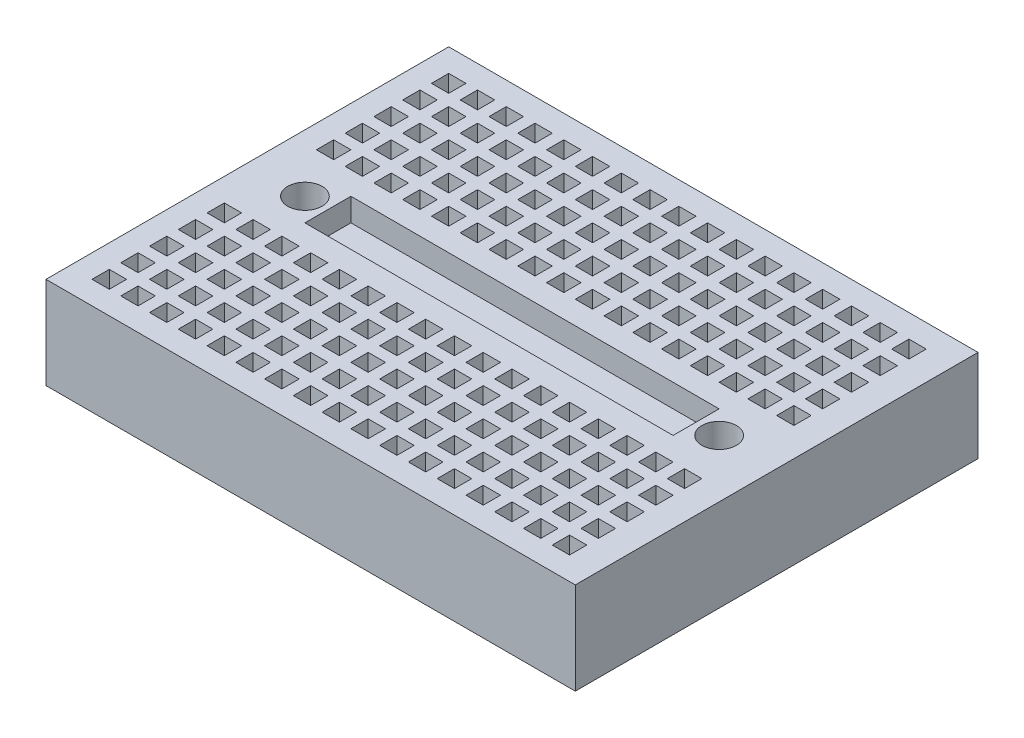
from build123d import *

# Parameters (mm, degrees)
SKETCH1_W           = 46
SKETCH1_H           = 35
SKETCH1_R           = 1.5
BOSS_EXTRUDE1_DEPTH = 8
SKETCH2_W           = 32
SKETCH2_H           = 4
CUT_EXTRUDE1_DEPTH  = 2
SKETCH3_W           = 1.5
SKETCH3_H           = 1.5
CUT_EXTRUDE2_DEPTH  = 7


with BuildPart() as part:
    # Sketch1 → Boss-Extrude1 (new body)
    with BuildSketch(Plane(origin=(0, 0, 0), x_dir=(1, 0, 0), z_dir=(0, 1, 0))):
        Rectangle(SKETCH1_W, SKETCH1_H)
        with Locations((18, 0)):
            Circle(SKETCH1_R, mode=Mode.SUBTRACT)
        with Locations((-18, 0)):
            Circle(SKETCH1_R, mode=Mode.SUBTRACT)
    extrude(amount=BOSS_EXTRUDE1_DEPTH)

    # Sketch2 → Cut-Extrude1 (cut)
    with BuildSketch(Plane(origin=(0, 8, 0), x_dir=(1, 0, 0), z_dir=(0, 1, 0))):
        Rectangle(SKETCH2_W, SKETCH2_H)
    extrude(amount=-CUT_EXTRUDE1_DEPTH, mode=Mode.SUBTRACT)

    # Sketch3 → Cut-Extrude2 (cut)
    with BuildSketch(Plane(origin=(0, 8, 0), x_dir=(1, 0, 0), z_dir=(0, 1, 0))):
        with Locations((-20.25, 14.75)):
            Rectangle(SKETCH3_W, SKETCH3_H)
        with Locations((-17.75, 14.75)):
            Rectangle(SKETCH3_W, SKETCH3_H)
        with Locations((-15.25, 14.75)):
            Rectangle(SKETCH3_W, SKETCH3_H)
        with Locations((-12.75, 14.75)):
            Rectangle(SKETCH3_W, SKETCH3_H)
        with Locations((-10.25, 14.75)):
            Rectangle(SKETCH3_W, SKETCH3_H)
        with Locations((-7.75, 14.75)):
            Rectangle(SKETCH3_W, SKETCH3_H)
        with Locations((-5.25, 14.75)):
            Rectangle(SKETCH3_W, SKETCH3_H)
        with Locations((-2.75, 14.75)):
            Rectangle(SKETCH3_W, SKETCH3_H)
        with Locations((-0.25, 14.75)):
            Rectangle(SKETCH3_W, SKETCH3_H)
        with Locations((2.25, 14.75)):
            Rectangle(SKETCH3_W, SKETCH3_H)
        with Locations((4.75, 14.75)):
            Rectangle(SKETCH3_W, SKETCH3_H)
        with Locations((7.25, 14.75)):
            Rectangle(SKETCH3_W, SKETCH3_H)
        with Locations((9.75, 14.75)):
            Rectangle(SKETCH3_W, SKETCH3_H)
        with Locations((12.25, 14.75)):
            Rectangle(SKETCH3_W, SKETCH3_H)
        with Locations((14.75, 14.75)):
            Rectangle(SKETCH3_W, SKETCH3_H)
        with Locations((17.25, 14.75)):
            Rectangle(SKETCH3_W, SKETCH3_H)
        with Locations((19.75, 14.75)):
            Rectangle(SKETCH3_W, SKETCH3_H)
        with Locations((-17.75, 12.25)):
            Rectangle(SKETCH3_W, SKETCH3_H)
        with Locations((-15.25, 12.25)):
            Rectangle(SKETCH3_W, SKETCH3_H)
        with Locations((-12.75, 12.25)):
            Rectangle(SKETCH3_W, SKETCH3_H)
        with Locations((-10.25, 12.25)):
            Rectangle(SKETCH3_W, SKETCH3_H)
        with Locations((-7.75, 12.25)):
            Rectangle(SKETCH3_W, SKETCH3_H)
        with Locations((-5.25, 12.25)):
            Rectangle(SKETCH3_W, SKETCH3_H)
        with Locations((-2.75, 12.25)):
            Rectangle(SKETCH3_W, SKETCH3_H)
        with Locations((-0.25, 12.25)):
            Rectangle(SKETCH3_W, SKETCH3_H)
        with Locations((2.25, 12.25)):
            Rectangle(SKETCH3_W, SKETCH3_H)
        with Locations((4.75, 12.25)):
            Rectangle(SKETCH3_W, SKETCH3_H)
        with Locations((7.25, 12.25)):
            Rectangle(SKETCH3_W, SKETCH3_H)
        with Locations((9.75, 12.25)):
            Rectangle(SKETCH3_W, SKETCH3_H)
        with Locations((12.25, 12.25)):
            Rectangle(SKETCH3_W, SKETCH3_H)
        with Locations((14.75, 12.25)):
            Rectangle(SKETCH3_W, SKETCH3_H)
        with Locations((17.25, 12.25)):
            Rectangle(SKETCH3_W, SKETCH3_H)
        with Locations((19.75, 12.25)):
            Rectangle(SKETCH3_W, SKETCH3_H)
        with Locations((-17.75, 9.75)):
            Rectangle(SKETCH3_W, SKETCH3_H)
        with Locations((-15.25, 9.75)):
            Rectangle(SKETCH3_W, SKETCH3_H)
        with Locations((-12.75, 9.75)):
            Rectangle(SKETCH3_W, SKETCH3_H)
        with Locations((-10.25, 9.75)):
            Rectangle(SKETCH3_W, SKETCH3_H)
        with Locations((-7.75, 9.75)):
            Rectangle(SKETCH3_W, SKETCH3_H)
        with Locations((-5.25, 9.75)):
            Rectangle(SKETCH3_W, SKETCH3_H)
        with Locations((-2.75, 9.75)):
            Rectangle(SKETCH3_W, SKETCH3_H)
        with Locations((-0.25, 9.75)):
            Rectangle(SKETCH3_W, SKETCH3_H)
        with Locations((2.25, 9.75)):
            Rectangle(SKETCH3_W, SKETCH3_H)
        with Locations((4.75, 9.75)):
            Rectangle(SKETCH3_W, SKETCH3_H)
        with Locations((7.25, 9.75)):
            Rectangle(SKETCH3_W, SKETCH3_H)
        with Locations((9.75, 9.75)):
            Rectangle(SKETCH3_W, SKETCH3_H)
        with Locations((12.25, 9.75)):
            Rectangle(SKETCH3_W, SKETCH3_H)
        with Locations((14.75, 9.75)):
            Rectangle(SKETCH3_W, SKETCH3_H)
        with Locations((17.25, 9.75)):
            Rectangle(SKETCH3_W, SKETCH3_H)
        with Locations((19.75, 9.75)):
            Rectangle(SKETCH3_W, SKETCH3_H)
        with Locations((-17.75, 7.25)):
            Rectangle(SKETCH3_W, SKETCH3_H)
        with Locations((-15.25, 7.25)):
            Rectangle(SKETCH3_W, SKETCH3_H)
        with Locations((-12.75, 7.25)):
            Rectangle(SKETCH3_W, SKETCH3_H)
        with Locations((-10.25, 7.25)):
            Rectangle(SKETCH3_W, SKETCH3_H)
        with Locations((-7.75, 7.25)):
            Rectangle(SKETCH3_W, SKETCH3_H)
        with Locations((-5.25, 7.25)):
            Rectangle(SKETCH3_W, SKETCH3_H)
        with Locations((-2.75, 7.25)):
            Rectangle(SKETCH3_W, SKETCH3_H)
        with Locations((-0.25, 7.25)):
            Rectangle(SKETCH3_W, SKETCH3_H)
        with Locations((2.25, 7.25)):
            Rectangle(SKETCH3_W, SKETCH3_H)
        with Locations((4.75, 7.25)):
            Rectangle(SKETCH3_W, SKETCH3_H)
        with Locations((7.25, 7.25)):
            Rectangle(SKETCH3_W, SKETCH3_H)
        with Locations((9.75, 7.25)):
            Rectangle(SKETCH3_W, SKETCH3_H)
        with Locations((12.25, 7.25)):
            Rectangle(SKETCH3_W, SKETCH3_H)
        with Locations((14.75, 7.25)):
            Rectangle(SKETCH3_W, SKETCH3_H)
        with Locations((17.25, 7.25)):
            Rectangle(SKETCH3_W, SKETCH3_H)
        with Locations((19.75, 7.25)):
            Rectangle(SKETCH3_W, SKETCH3_H)
        with Locations((-17.75, 4.75)):
            Rectangle(SKETCH3_W, SKETCH3_H)
        with Locations((-15.25, 4.75)):
            Rectangle(SKETCH3_W, SKETCH3_H)
        with Locations((-12.75, 4.75)):
            Rectangle(SKETCH3_W, SKETCH3_H)
        with Locations((-10.25, 4.75)):
            Rectangle(SKETCH3_W, SKETCH3_H)
        with Locations((-7.75, 4.75)):
            Rectangle(SKETCH3_W, SKETCH3_H)
        with Locations((-5.25, 4.75)):
            Rectangle(SKETCH3_W, SKETCH3_H)
        with Locations((-2.75, 4.75)):
            Rectangle(SKETCH3_W, SKETCH3_H)
        with Locations((-0.25, 4.75)):
            Rectangle(SKETCH3_W, SKETCH3_H)
        with Locations((2.25, 4.75)):
            Rectangle(SKETCH3_W, SKETCH3_H)
        with Locations((4.75, 4.75)):
            Rectangle(SKETCH3_W, SKETCH3_H)
        with Locations((7.25, 4.75)):
            Rectangle(SKETCH3_W, SKETCH3_H)
        with Locations((9.75, 4.75)):
            Rectangle(SKETCH3_W, SKETCH3_H)
        with Locations((12.25, 4.75)):
            Rectangle(SKETCH3_W, SKETCH3_H)
        with Locations((14.75, 4.75)):
            Rectangle(SKETCH3_W, SKETCH3_H)
        with Locations((17.25, 4.75)):
            Rectangle(SKETCH3_W, SKETCH3_H)
        with Locations((19.75, 4.75)):
            Rectangle(SKETCH3_W, SKETCH3_H)
        with Locations((-20.25, 12.25)):
            Rectangle(SKETCH3_W, SKETCH3_H)
        with Locations((-20.25, 9.75)):
            Rectangle(SKETCH3_W, SKETCH3_H)
        with Locations((-20.25, 7.25)):
            Rectangle(SKETCH3_W, SKETCH3_H)
        with Locations((-20.25, 4.75)):
            Rectangle(SKETCH3_W, SKETCH3_H)
        with Locations((-20.25, -4.75)):
            Rectangle(SKETCH3_W, SKETCH3_H)
        with Locations((-20.25, -7.25)):
            Rectangle(SKETCH3_W, SKETCH3_H)
        with Locations((-20.25, -9.75)):
            Rectangle(SKETCH3_W, SKETCH3_H)
        with Locations((-20.25, -12.25)):
            Rectangle(SKETCH3_W, SKETCH3_H)
        with Locations((19.75, -4.75)):
            Rectangle(SKETCH3_W, SKETCH3_H)
        with Locations((17.25, -4.75)):
            Rectangle(SKETCH3_W, SKETCH3_H)
        with Locations((14.75, -4.75)):
            Rectangle(SKETCH3_W, SKETCH3_H)
        with Locations((12.25, -4.75)):
            Rectangle(SKETCH3_W, SKETCH3_H)
        with Locations((9.75, -4.75)):
            Rectangle(SKETCH3_W, SKETCH3_H)
        with Locations((7.25, -4.75)):
            Rectangle(SKETCH3_W, SKETCH3_H)
        with Locations((4.75, -4.75)):
            Rectangle(SKETCH3_W, SKETCH3_H)
        with Locations((2.25, -4.75)):
            Rectangle(SKETCH3_W, SKETCH3_H)
        with Locations((-0.25, -4.75)):
            Rectangle(SKETCH3_W, SKETCH3_H)
        with Locations((-2.75, -4.75)):
            Rectangle(SKETCH3_W, SKETCH3_H)
        with Locations((-5.25, -4.75)):
            Rectangle(SKETCH3_W, SKETCH3_H)
        with Locations((-7.75, -4.75)):
            Rectangle(SKETCH3_W, SKETCH3_H)
        with Locations((-10.25, -4.75)):
            Rectangle(SKETCH3_W, SKETCH3_H)
        with Locations((-12.75, -4.75)):
            Rectangle(SKETCH3_W, SKETCH3_H)
        with Locations((-15.25, -4.75)):
            Rectangle(SKETCH3_W, SKETCH3_H)
        with Locations((-17.75, -4.75)):
            Rectangle(SKETCH3_W, SKETCH3_H)
        with Locations((19.75, -7.25)):
            Rectangle(SKETCH3_W, SKETCH3_H)
        with Locations((17.25, -7.25)):
            Rectangle(SKETCH3_W, SKETCH3_H)
        with Locations((14.75, -7.25)):
            Rectangle(SKETCH3_W, SKETCH3_H)
        with Locations((12.25, -7.25)):
            Rectangle(SKETCH3_W, SKETCH3_H)
        with Locations((9.75, -7.25)):
            Rectangle(SKETCH3_W, SKETCH3_H)
        with Locations((7.25, -7.25)):
            Rectangle(SKETCH3_W, SKETCH3_H)
        with Locations((4.75, -7.25)):
            Rectangle(SKETCH3_W, SKETCH3_H)
        with Locations((2.25, -7.25)):
            Rectangle(SKETCH3_W, SKETCH3_H)
        with Locations((-0.25, -7.25)):
            Rectangle(SKETCH3_W, SKETCH3_H)
        with Locations((-2.75, -7.25)):
            Rectangle(SKETCH3_W, SKETCH3_H)
        with Locations((-5.25, -7.25)):
            Rectangle(SKETCH3_W, SKETCH3_H)
        with Locations((-7.75, -7.25)):
            Rectangle(SKETCH3_W, SKETCH3_H)
        with Locations((-10.25, -7.25)):
            Rectangle(SKETCH3_W, SKETCH3_H)
        with Locations((-12.75, -7.25)):
            Rectangle(SKETCH3_W, SKETCH3_H)
        with Locations((-15.25, -7.25)):
            Rectangle(SKETCH3_W, SKETCH3_H)
        with Locations((-17.75, -7.25)):
            Rectangle(SKETCH3_W, SKETCH3_H)
        with Locations((19.75, -9.75)):
            Rectangle(SKETCH3_W, SKETCH3_H)
        with Locations((17.25, -9.75)):
            Rectangle(SKETCH3_W, SKETCH3_H)
        with Locations((14.75, -9.75)):
            Rectangle(SKETCH3_W, SKETCH3_H)
        with Locations((12.25, -9.75)):
            Rectangle(SKETCH3_W, SKETCH3_H)
        with Locations((9.75, -9.75)):
            Rectangle(SKETCH3_W, SKETCH3_H)
        with Locations((7.25, -9.75)):
            Rectangle(SKETCH3_W, SKETCH3_H)
        with Locations((4.75, -9.75)):
            Rectangle(SKETCH3_W, SKETCH3_H)
        with Locations((2.25, -9.75)):
            Rectangle(SKETCH3_W, SKETCH3_H)
        with Locations((-0.25, -9.75)):
            Rectangle(SKETCH3_W, SKETCH3_H)
        with Locations((-2.75, -9.75)):
            Rectangle(SKETCH3_W, SKETCH3_H)
        with Locations((-5.25, -9.75)):
            Rectangle(SKETCH3_W, SKETCH3_H)
        with Locations((-7.75, -9.75)):
            Rectangle(SKETCH3_W, SKETCH3_H)
        with Locations((-10.25, -9.75)):
            Rectangle(SKETCH3_W, SKETCH3_H)
        with Locations((-12.75, -9.75)):
            Rectangle(SKETCH3_W, SKETCH3_H)
        with Locations((-15.25, -9.75)):
            Rectangle(SKETCH3_W, SKETCH3_H)
        with Locations((-17.75, -9.75)):
            Rectangle(SKETCH3_W, SKETCH3_H)
        with Locations((19.75, -12.25)):
            Rectangle(SKETCH3_W, SKETCH3_H)
        with Locations((17.25, -12.25)):
            Rectangle(SKETCH3_W, SKETCH3_H)
        with Locations((14.75, -12.25)):
            Rectangle(SKETCH3_W, SKETCH3_H)
        with Locations((12.25, -12.25)):
            Rectangle(SKETCH3_W, SKETCH3_H)
        with Locations((9.75, -12.25)):
            Rectangle(SKETCH3_W, SKETCH3_H)
        with Locations((7.25, -12.25)):
            Rectangle(SKETCH3_W, SKETCH3_H)
        with Locations((4.75, -12.25)):
            Rectangle(SKETCH3_W, SKETCH3_H)
        with Locations((2.25, -12.25)):
            Rectangle(SKETCH3_W, SKETCH3_H)
        with Locations((-0.25, -12.25)):
            Rectangle(SKETCH3_W, SKETCH3_H)
        with Locations((-2.75, -12.25)):
            Rectangle(SKETCH3_W, SKETCH3_H)
        with Locations((-5.25, -12.25)):
            Rectangle(SKETCH3_W, SKETCH3_H)
        with Locations((-7.75, -12.25)):
            Rectangle(SKETCH3_W, SKETCH3_H)
        with Locations((-10.25, -12.25)):
            Rectangle(SKETCH3_W, SKETCH3_H)
        with Locations((-12.75, -12.25)):
            Rectangle(SKETCH3_W, SKETCH3_H)
        with Locations((-15.25, -12.25)):
            Rectangle(SKETCH3_W, SKETCH3_H)
        with Locations((-17.75, -12.25)):
            Rectangle(SKETCH3_W, SKETCH3_H)
        with Locations((19.75, -14.75)):
            Rectangle(SKETCH3_W, SKETCH3_H)
        with Locations((17.25, -14.75)):
            Rectangle(SKETCH3_W, SKETCH3_H)
        with Locations((14.75, -14.75)):
            Rectangle(SKETCH3_W, SKETCH3_H)
        with Locations((12.25, -14.75)):
            Rectangle(SKETCH3_W, SKETCH3_H)
        with Locations((9.75, -14.75)):
            Rectangle(SKETCH3_W, SKETCH3_H)
        with Locations((7.25, -14.75)):
            Rectangle(SKETCH3_W, SKETCH3_H)
        with Locations((4.75, -14.75)):
            Rectangle(SKETCH3_W, SKETCH3_H)
        with Locations((2.25, -14.75)):
            Rectangle(SKETCH3_W, SKETCH3_H)
        with Locations((-0.25, -14.75)):
            Rectangle(SKETCH3_W, SKETCH3_H)
        with Locations((-2.75, -14.75)):
            Rectangle(SKETCH3_W, SKETCH3_H)
        with Locations((-5.25, -14.75)):
            Rectangle(SKETCH3_W, SKETCH3_H)
        with Locations((-7.75, -14.75)):
            Rectangle(SKETCH3_W, SKETCH3_H)
        with Locations((-10.25, -14.75)):
            Rectangle(SKETCH3_W, SKETCH3_H)
        with Locations((-12.75, -14.75)):
            Rectangle(SKETCH3_W, SKETCH3_H)
        with Locations((-15.25, -14.75)):
            Rectangle(SKETCH3_W, SKETCH3_H)
        with Locations((-17.75, -14.75)):
            Rectangle(SKETCH3_W, SKETCH3_H)
        with Locations((-20.25, -14.75)):
            Rectangle(SKETCH3_W, SKETCH3_H)
    extrude(amount=-CUT_EXTRUDE2_DEPTH, mode=Mode.SUBTRACT)


solid = part.part
